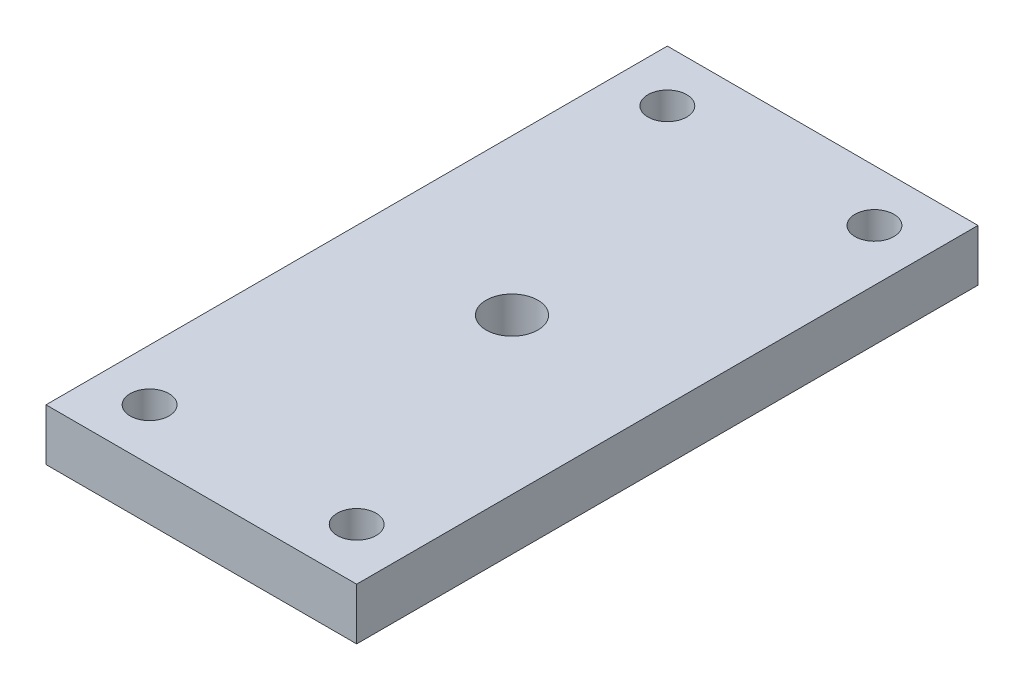
from build123d import *

# Parameters (mm, degrees)
SKETCH1_W           = 76.2
SKETCH1_H           = 152.4
SKETCH1_R           = 6.35
BOSS_EXTRUDE1_DEPTH = 12.7
SKETCH2_R           = 4.7625
CUT_EXTRUDE1_DEPTH  = 87.135590786


with BuildPart() as part:
    # Sketch1 → Boss-Extrude1 (new body)
    with BuildSketch(Plane(origin=(0, 0, 0), x_dir=(1, 0, 0), z_dir=(0, 1, 0))):
        Rectangle(SKETCH1_W, SKETCH1_H)
        Circle(SKETCH1_R, mode=Mode.SUBTRACT)
    extrude(amount=BOSS_EXTRUDE1_DEPTH)

    # Sketch2 → Cut-Extrude1 (cut, through all)
    with BuildSketch(Plane(origin=(0, 12.7, 0), x_dir=(1, 0, 0), z_dir=(0, 1, 0))):
        with Locations((-25.4, 63.5)):
            Circle(SKETCH2_R)
        with Locations((-25.4, -63.5)):
            Circle(SKETCH2_R)
        with Locations((25.4, -63.5)):
            Circle(SKETCH2_R)
        with Locations((25.4, 63.5)):
            Circle(SKETCH2_R)
    extrude(amount=-CUT_EXTRUDE1_DEPTH, mode=Mode.SUBTRACT)


solid = part.part
